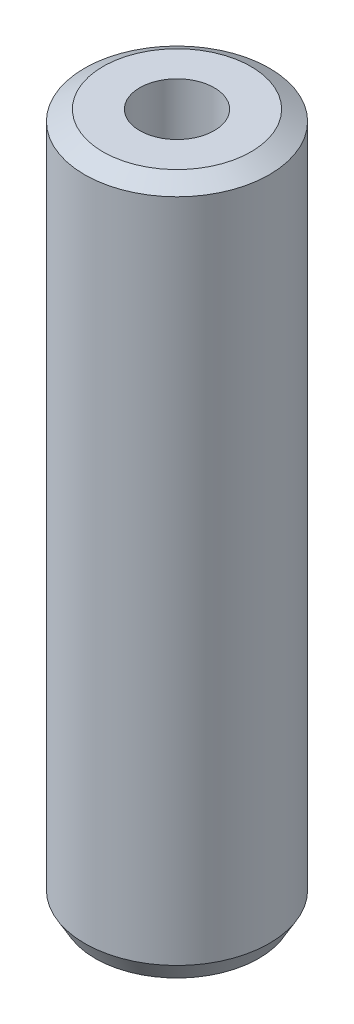
from build123d import *
from OCP.BRepFilletAPI import BRepFilletAPI_MakeChamfer

# Parameters (mm, degrees)
SKETCH1_R           = 35
BOSS_EXTRUDE1_DEPTH = 263.253868498
SKETCH2_R           = 14.112805206
CUT_EXTRUDE1_DEPTH  = 268.866756577
CHAMFER1_SIZE       = 4.016177874
CHAMFER1_SIZE2      = 6.95622413


with BuildPart() as part:
    # Sketch1 → Boss-Extrude1 (new body)
    with BuildSketch(Plane(origin=(0, 0, 0), x_dir=(1, 0, 0), z_dir=(0, 1, 0))):
        Circle(SKETCH1_R)
    extrude(amount=BOSS_EXTRUDE1_DEPTH)

    # Sketch2 → Cut-Extrude1 (cut, through all)
    with BuildSketch(Plane(origin=(0, 0, 0), x_dir=(1, 0, 0), z_dir=(0, 1, 0))):
        Circle(SKETCH2_R)
    extrude(amount=CUT_EXTRUDE1_DEPTH, mode=Mode.SUBTRACT)

    # Chamfer1: one chamfer whose edges measure the first distance from different faces: ONE call of the kernel's chamfer builder (chamfer() names one face for all edges)
    chamfer1_edges_1 = [part.edges().sort_by_distance(p)[0] for p in [
        (-35, 263.253868498, 0),
    ]]
    chamfer1_side_1 = [part.faces().sort_by_distance(p)[0] for p in [
        (-35, 131.626934249, 0),
    ]]
    chamfer1_edges_2 = [part.edges().sort_by_distance(p)[0] for p in [
        (-35, 0, 0),
    ]]
    chamfer1_side_2 = [part.faces().sort_by_distance(p)[0] for p in [
        (-34.010050506, 0, 0),
    ]]
    chamfer1 = BRepFilletAPI_MakeChamfer(part.part.solid().wrapped)
    for e in chamfer1_edges_1:
        chamfer1.Add(CHAMFER1_SIZE, CHAMFER1_SIZE2, e.wrapped, chamfer1_side_1[0].wrapped)  # the first distance lies on this face
    for e in chamfer1_edges_2:
        chamfer1.Add(CHAMFER1_SIZE, CHAMFER1_SIZE2, e.wrapped, chamfer1_side_2[0].wrapped)  # the first distance lies on this face
    add(Compound.cast(chamfer1.Shape()), mode=Mode.REPLACE)


solid = part.part
